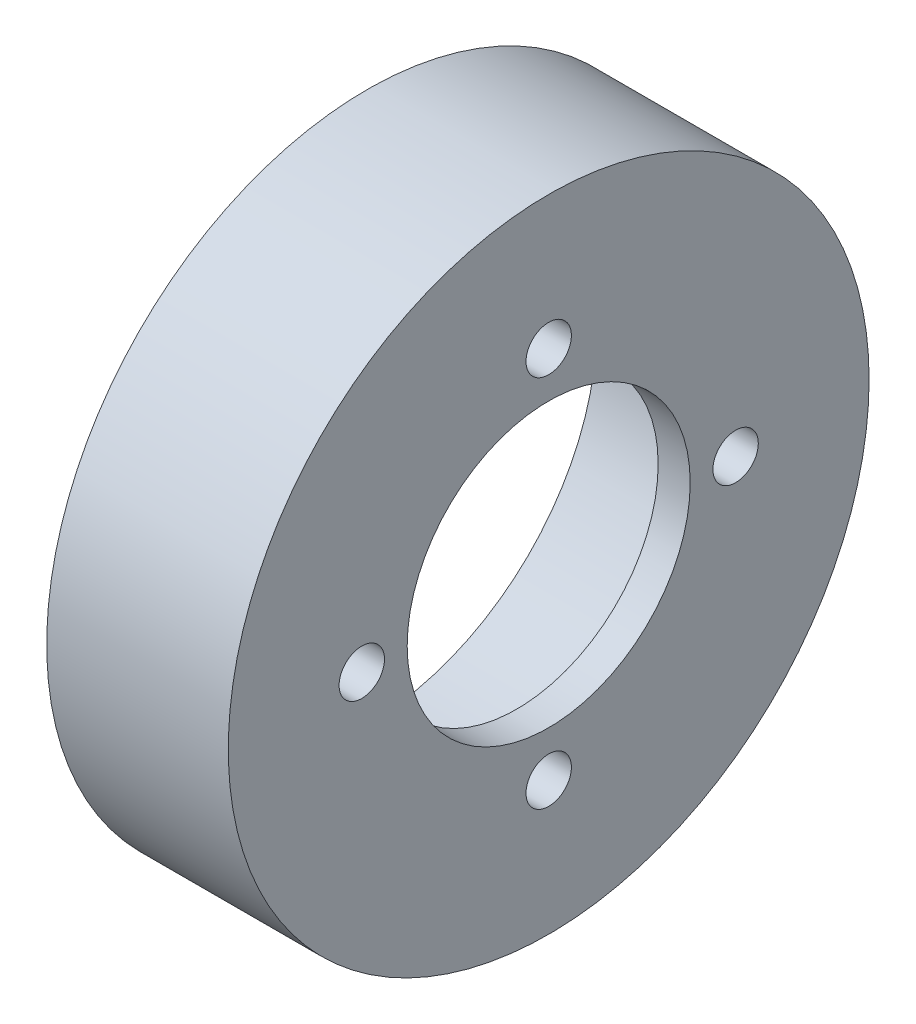
from build123d import *

# Parameters (mm, degrees)
SKETCH1_R           = 30
SKETCH1_R_2         = 21.5
BOSS_EXTRUDE1_DEPTH = 14
SKETCH2_R           = 30
SKETCH2_R_2         = 2.125
SKETCH2_R_3         = 13.25
BOSS_EXTRUDE2_DEPTH = 3


with BuildPart() as part:
    # Sketch1 → Boss-Extrude1 (new body)
    with BuildSketch(Plane(origin=(0, 0, 0), x_dir=(0, 0, -1), z_dir=(1, 0, 0))):
        Circle(SKETCH1_R)
        Circle(SKETCH1_R_2, mode=Mode.SUBTRACT)
    extrude(amount=BOSS_EXTRUDE1_DEPTH)

    # Sketch2 → Boss-Extrude2 (add)
    with BuildSketch(Plane(origin=(14, 0, 0), x_dir=(0, 0, -1), z_dir=(1, 0, 0))):
        Circle(SKETCH2_R)
        with Locations((0, 17.5)):
            Circle(SKETCH2_R_2, mode=Mode.SUBTRACT)
        with Locations((17.5, 0)):
            Circle(SKETCH2_R_2, mode=Mode.SUBTRACT)
        with Locations((0, -17.5)):
            Circle(SKETCH2_R_2, mode=Mode.SUBTRACT)
        with Locations((-17.5, 0)):
            Circle(SKETCH2_R_2, mode=Mode.SUBTRACT)
        Circle(SKETCH2_R_3, mode=Mode.SUBTRACT)
    extrude(amount=BOSS_EXTRUDE2_DEPTH)


solid = part.part
